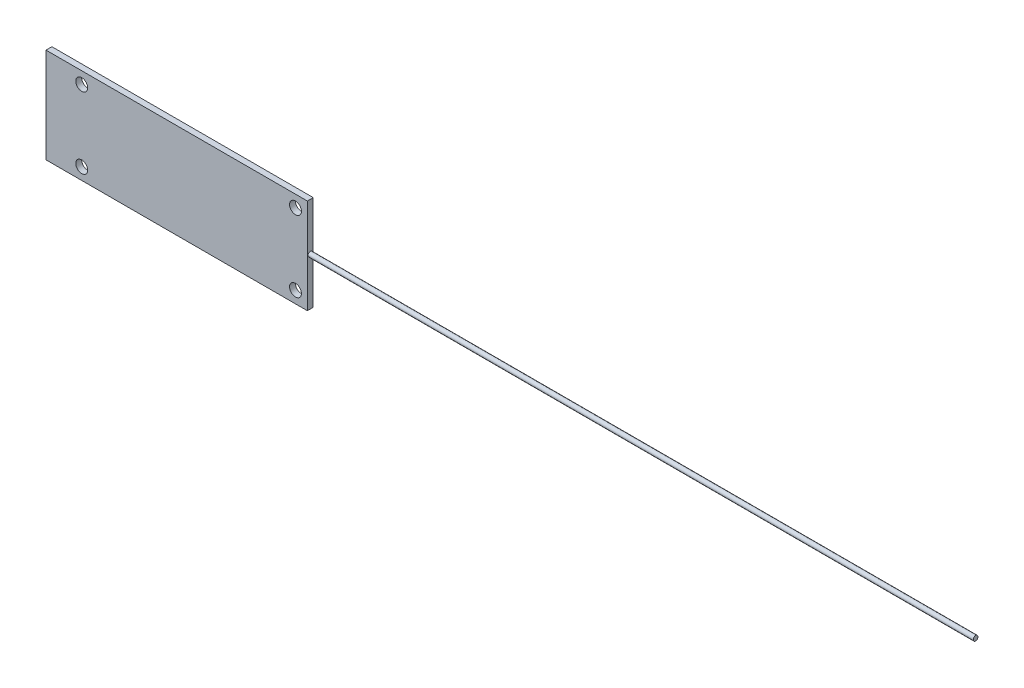
from build123d import *

# Parameters (mm, degrees)
SKETCH1_W                             = 69.85
SKETCH1_H                             = 25.4
EXTRUDE1_DEPTH                        = 1.5748
F_1_8_0_125_DIAMETER_HOLE1_AT_2_COUNT = 2
F_1_8_0_125_DIAMETER_HOLE1_AT_2_PITCH = 57.13222
SKETCH4_R                             = 0.635
BOSS_EXTRUDE1_DEPTH                   = 177.8


with BuildPart() as part:
    # Sketch1 → Extrude1 (new body)
    with BuildSketch(Plane.XY):
        Rectangle(SKETCH1_W, SKETCH1_H)
    extrude(amount=EXTRUDE1_DEPTH)

    # Sketch3 → 1/8 (0.125) Diameter Hole1 (revolve, cut)
    with BuildSketch(Plane(origin=(-25.38222, 9.525, 1.5748), x_dir=(0, -1, 0), z_dir=(1, 0, 0))):
        Polygon((0, 0), (0, 16.955866233), (1.5875, 16.002), (1.5875, 0), align=None)
    f_1_8_0_125_diameter_hole1 = revolve(axis=Axis((-25.38222, 9.525, 7.9248), (0, 0, -1)), mode=Mode.SUBTRACT)

    # 1/8 (0.125) Diameter Hole1 at 2: 1/8 (0.125) Diameter Hole1 ×2
    with Locations(*[(i * F_1_8_0_125_DIAMETER_HOLE1_AT_2_PITCH, 0, 0) for i in range(1, F_1_8_0_125_DIAMETER_HOLE1_AT_2_COUNT)]):
        add(f_1_8_0_125_diameter_hole1, mode=Mode.SUBTRACT)

    # Mirror1: 1/8 (0.125) Diameter Hole1 across plane
    add(f_1_8_0_125_diameter_hole1.mirror(Plane.ZX), mode=Mode.SUBTRACT)

    # Mirror1 copy 1 sketch → Mirror1 copy 1 (revolve, cut)
    with BuildSketch(Plane(origin=(31.75, -9.525, 1.5748), x_dir=(0, 1, 0), z_dir=(1, 0, 0))):
        Polygon((0, 0), (0, -16.955866233), (1.5875, -16.002), (1.5875, 0), align=None)
    revolve(axis=Axis((31.75, -9.525, 7.9248), (0, 0, 1)), mode=Mode.SUBTRACT)

    # Sketch4 → Boss-Extrude1 (add)
    with BuildSketch(Plane(origin=(34.925, 0, 0), x_dir=(0, 0, -1), z_dir=(1, 0, 0))):
        with Locations((-0.772028936, 0)):
            Circle(SKETCH4_R)
    extrude(amount=BOSS_EXTRUDE1_DEPTH)


solid = part.part
